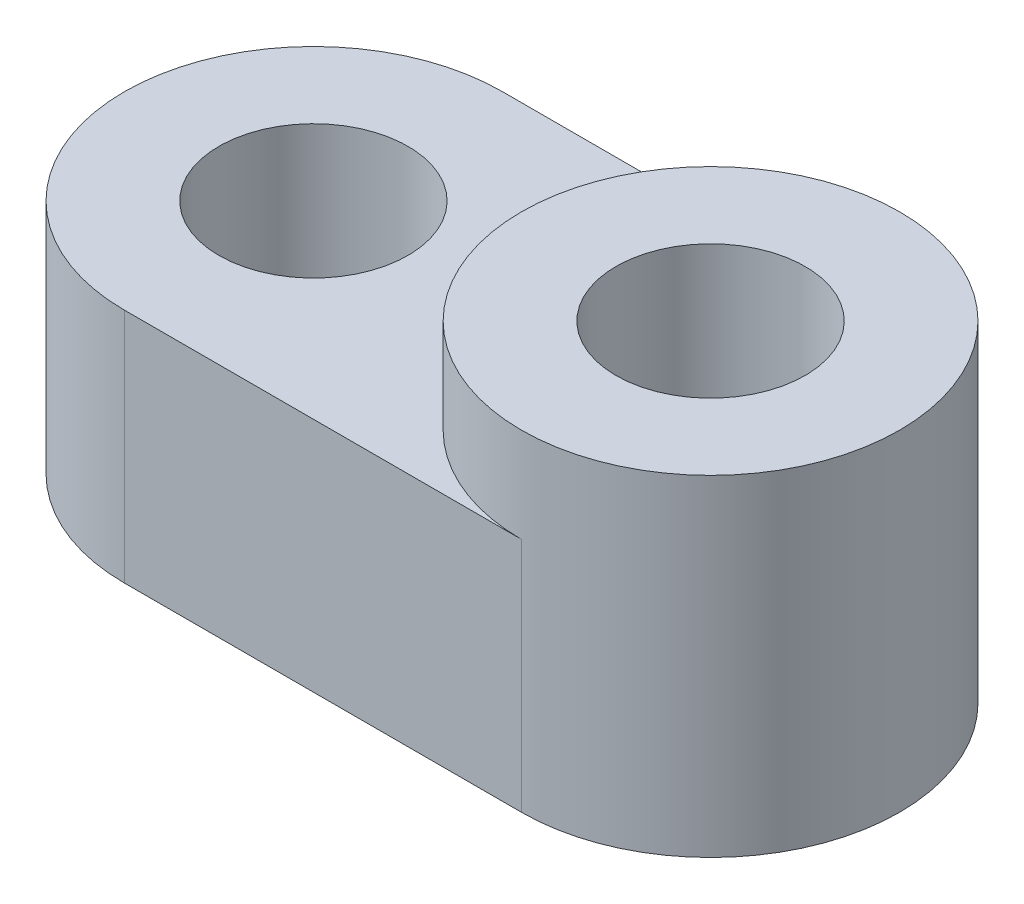
from build123d import *
from build123d.topology import SkipClean

# Parameters (mm, degrees)
SKETCH_1_R      = 2
EXTRUDE_1_DEPTH = 5
SKETCH_2_R      = 4
SKETCH_2_R_2    = 2
EXTRUDE_2_DEPTH = 2


with BuildPart() as part:
    # 草图1 → 凸台-拉伸1 (new body)
    with BuildSketch(Plane(origin=(0, 0, 0), x_dir=(1, 0, 0), z_dir=(0, 1, 0))):
        with BuildLine():
            Line((0, 4), (8.4, 4))
            ThreePointArc((8.4, 4), (12.4, 0), (8.4, -4))
            Line((8.4, -4), (0, -4))
            ThreePointArc((0, -4), (-4, 0), (0, 4))
        make_face()
        Circle(SKETCH_1_R, mode=Mode.SUBTRACT)
        with Locations((8.4, 0)):
            Circle(SKETCH_1_R, mode=Mode.SUBTRACT)
    extrude(amount=EXTRUDE_1_DEPTH)

    # 草图2 → 凸台-拉伸2 (add)
    with SkipClean():  # the faces are left unmerged after this step: merging them gives an invalid solid
        with BuildSketch(Plane(origin=(0, 5, 0), x_dir=(1, 0, 0), z_dir=(0, 1, 0))):
            with Locations((8.4, 0)):
                Circle(SKETCH_2_R)
            with Locations((8.4, 0)):
                Circle(SKETCH_2_R_2, mode=Mode.SUBTRACT)
        extrude(amount=EXTRUDE_2_DEPTH)
    add(part.part.scale(1), mode=Mode.REPLACE)  # the faces are merged on a copy


solid = part.part
